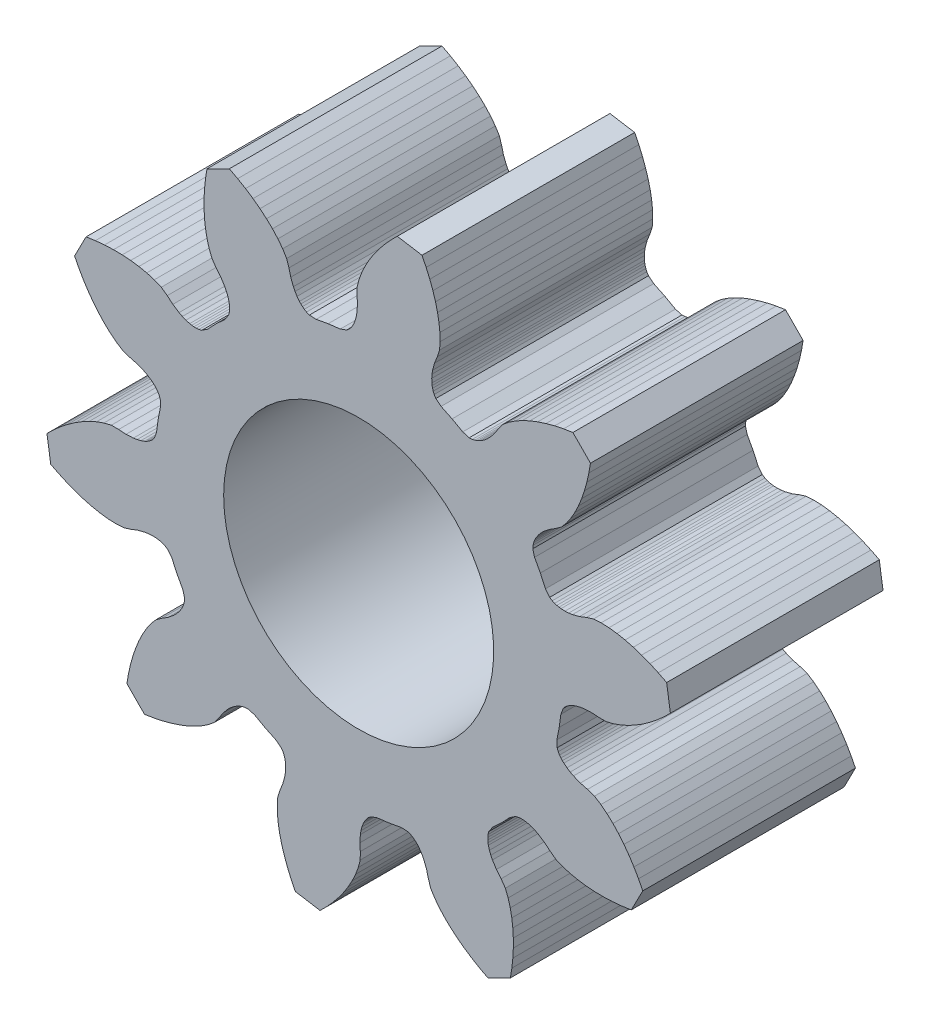
from build123d import *

# Parameters (mm, degrees)
EXTRUDE_GEAR_FACE_DEPTH = 10
SKETCH3_R               = 6.35
CUT_EXTRUDE1_DEPTH      = 24.004392687


with BuildPart() as part:
    # Sketch1 → Extrude gear face (new body)
    with BuildSketch(Plane.XY):
        Polygon((-8.785755588, -3.765027458), (-8.981475588, -3.515627458), (-9.104375588, -3.437067458), (-9.214815588, -3.388487458), (-9.318645588, -3.356197458), (-9.418135588, -3.334867458), (-9.514485588, -3.321697458), (-9.700295588, -3.313797458), (-9.879345588, -3.324657458), (-10.053295588, -3.350207458), (-10.389375588, -3.436367458), (-10.712795588, -3.560677458), (-11.043055588, -3.664357458), (-11.399975588, -3.686587458), (-11.767875588, -3.671647458), (-12.143785588, -3.625627458), (-12.525865588, -3.551357458), (-12.912635588, -3.450417458), (-13.302835588, -3.323837458), (-13.695295588, -3.172277458), (-14.088935588, -2.996237458), (-14.482675588, -2.796087458), (-14.659535588, -1.632117458), (-14.343025588, -1.324037458), (-14.019445588, -1.039017458), (-13.689715588, -0.777727458), (-13.354725588, -0.540947458), (-13.015395588, -0.329677458), (-12.672625588, -0.145267458), (-12.327345588, 0.010332542), (-11.980495588, 0.133882542), (-11.633085588, 0.218672542), (-11.286925588, 0.217772542), (-10.941175588, 0.195142542), (-10.594675588, 0.212702542), (-10.420995588, 0.239972542), (-10.246795588, 0.282782542), (-10.071725588, 0.345532542), (-9.983635588, 0.386722542), (-9.894965588, 0.436642542), (-9.805415588, 0.498312542), (-9.714385588, 0.577512542), (-9.620365588, 0.689032542), (-9.507565588, 0.985312542), (-9.431215588, 1.554652542), (-9.320805588, 2.118382542), (-9.332545588, 2.435192542), (-9.385805588, 2.570982542), (-9.446595588, 2.675212542), (-9.511615588, 2.762362542), (-9.579565588, 2.838102542), (-9.649775588, 2.905382542), (-9.795455588, 3.020992542), (-9.946695588, 3.117452542), (-10.102435588, 3.199022542), (-10.424975588, 3.326862542), (-10.759695588, 3.416392542), (-11.087825588, 3.526632542), (-11.389645588, 3.718442542), (-11.678495588, 3.946782542), (-11.955575588, 4.204962542), (-12.221015588, 4.489632542), (-12.474595588, 4.798622542), (-12.715865588, 5.130392542), (-12.944295588, 5.483682542), (-13.159275588, 5.857472542), (-13.360175588, 6.250842542), (-12.819095588, 7.296472542), (-12.381945588, 7.359662542), (-11.952645588, 7.400052542), (-11.532295588, 7.417632542), (-11.122115588, 7.412292542), (-10.723405588, 7.383762542), (-10.337705588, 7.331482542), (-9.966915588, 7.254412542), (-9.613685588, 7.150492542), (-9.282775588, 7.014882542), (-9.003265588, 6.810692542), (-8.736845588, 6.589162542), (-8.446195588, 6.399692542), (-8.289655588, 6.319672542), (-8.123565588, 6.251912542), (-7.945045588, 6.199772542), (-7.849565588, 6.181312542), (-7.748485588, 6.169592542), (-7.639795588, 6.166842542), (-7.519595588, 6.177412542), (-7.377995588, 6.212372542), (-7.112585588, 6.385762542), (-6.716155588, 6.801492542), (-6.295475588, 7.192662542), (-6.118765588, 7.455872542), (-6.082035588, 7.597022542), (-6.069955588, 7.717082542), (-6.071335588, 7.825802542), (-6.081785588, 7.927022542), (-6.099045588, 8.022722542), (-6.148945588, 8.201882542), (-6.214605588, 8.368812542), (-6.292655588, 8.526342542), (-6.478445588, 8.819352542), (-6.696615588, 9.088532542), (-6.897285588, 9.370582542), (-7.028725588, 9.703172542), (-7.128195588, 10.057682542), (-7.200595588, 10.429412542), (-7.248025588, 10.815742542), (-7.271545588, 11.214772542), (-7.271735588, 11.624992542), (-7.248875588, 12.045082542), (-7.203095588, 12.473852542), (-7.134405588, 12.910172542), (-6.082065588, 13.438062542), (-5.691255588, 13.232242542), (-5.320195588, 13.012582542), (-4.969795588, 12.779732542), (-4.641085588, 12.534302542), (-4.335305588, 12.276862542), (-4.053995588, 12.007862542), (-3.799315588, 11.727562542), (-3.574625588, 11.435872542), (-3.386625588, 11.131662542), (-3.280515588, 10.802172542), (-3.195195588, 10.466352542), (-3.071425588, 10.142232542), (-2.991815588, 9.985472542), (-2.897265588, 9.833042542), (-2.783495588, 9.685922542), (-2.717095588, 9.614872542), (-2.642215588, 9.545972542), (-2.555895588, 9.479852542), (-2.452435588, 9.417762542), (-2.317335588, 9.362802542), (-2.000695588, 9.347082542), (-1.435615588, 9.450402542), (-0.865355588, 9.519592542), (-0.567685588, 9.628662542), (-0.454995588, 9.721272542), (-0.374655588, 9.811292542), (-0.311875588, 9.900062542), (-0.260835588, 9.988102542), (-0.218545588, 10.075662542), (-0.153605588, 10.249942542), (-0.108605588, 10.423582542), (-0.079155588, 10.596902542), (-0.057245588, 10.943162542), (-0.075525588, 11.289172542), (-0.072075588, 11.635302542), (0.017074412, 11.981632542), (0.144974412, 12.326902542), (0.304904412, 12.670202542), (0.493604412, 13.010622542), (0.709124412, 13.347272542), (0.950094412, 13.679252542), (1.215504412, 14.005682542), (1.504574412, 14.325642542), (1.816604412, 14.638262542), (2.978254412, 14.446792542), (3.173444412, 14.050562542), (3.344524412, 13.654752542), (3.491134412, 13.260412542), (3.612814412, 12.868652542), (3.708874412, 12.480642542), (3.778344412, 12.097662542), (3.819634412, 11.721202542), (3.829954412, 11.353142542), (3.803234412, 10.996532542), (3.695414412, 10.667602542), (3.567044412, 10.345762542), (3.476674412, 10.010792542), (3.448934412, 9.837182542), (3.435824412, 9.658292542), (3.441394412, 9.472392542), (3.453354412, 9.375882542), (3.473434412, 9.276122542), (3.504404412, 9.171902542), (3.551604412, 9.060862542), (3.628614412, 8.936982542), (3.875534412, 8.738142542), (4.393414412, 8.489592542), (4.895434412, 8.210382542), (5.200374412, 8.123652542), (5.345974412, 8.132332542), (5.463884412, 8.157942542), (5.566854412, 8.192852542), (5.659894412, 8.234072542), (5.745574412, 8.280062542), (5.900544412, 8.382882542), (6.039014412, 8.496912542), (6.164724412, 8.619822542), (6.385974412, 8.887072542), (6.574564412, 9.177742542), (6.780804412, 9.455742542), (7.056494412, 9.683522542), (7.362904412, 9.887682542), (7.694074412, 10.071412542), (8.046834412, 10.235892542), (8.419074412, 10.381572542), (8.809154412, 10.508522542), (9.215754412, 10.616592542), (9.637674412, 10.705542542), (10.073864412, 10.775052542), (10.901124412, 9.937342542), (10.826134412, 9.502062542), (10.731884412, 9.081282542), (10.618714412, 8.676082542), (10.486874412, 8.287622542), (10.336534412, 7.917252542), (10.167624412, 7.566582542), (9.979744412, 7.237742542), (9.771754412, 6.933922542), (9.540534412, 6.661112542), (9.259954412, 6.458382542), (8.966944412, 6.273462542), (8.696934412, 6.055582542), (8.572454412, 5.931432542), (8.456694412, 5.794412542), (8.351934412, 5.640742542), (8.304874412, 5.555642542), (8.262484412, 5.463132542), (8.226284412, 5.360602542), (8.199204412, 5.243022542), (8.188684412, 5.097542542), (8.271574412, 4.791552542), (8.544454412, 4.286062542), (8.786484412, 3.765092542), (8.982204412, 3.515692542), (9.105104412, 3.437132542), (9.215544412, 3.388542542), (9.319364412, 3.356262542), (9.418864412, 3.334932542), (9.515214412, 3.321762542), (9.701024412, 3.313862542), (9.880074412, 3.324722542), (10.054014412, 3.350272542), (10.390094412, 3.436432542), (10.713524412, 3.560732542), (11.043784412, 3.664422542), (11.400704412, 3.686652542), (11.768604412, 3.671712542), (12.144514412, 3.625692542), (12.526594412, 3.551422542), (12.913364412, 3.450482542), (13.303564412, 3.323902542), (13.696024412, 3.172342542), (14.089654412, 2.996302542), (14.483404412, 2.796152542), (14.660264412, 1.632182542), (14.343754412, 1.324102542), (14.020174412, 1.039082542), (13.690444412, 0.777792542), (13.355454412, 0.541012542), (13.016124412, 0.329742542), (12.673354412, 0.145332542), (12.328074412, -0.010267458), (11.981224412, -0.133817458), (11.633804412, -0.218607458), (11.287654412, -0.217707458), (10.941904412, -0.195077458), (10.595404412, -0.212637458), (10.421724412, -0.239907458), (10.247524412, -0.282727458), (10.072454412, -0.345467458), (9.984364412, -0.386657458), (9.895694412, -0.436577458), (9.806144412, -0.498247458), (9.715114412, -0.577447458), (9.621094412, -0.688967458), (9.508294412, -0.985247458), (9.431944412, -1.554587458), (9.321524412, -2.118327458), (9.333274412, -2.435137458), (9.386524412, -2.570917458), (9.447314412, -2.675147458), (9.512344412, -2.762297458), (9.580294412, -2.838037458), (9.650504412, -2.905317458), (9.796184412, -3.020937458), (9.947424412, -3.117387458), (10.103164412, -3.198957458), (10.425704412, -3.326797458), (10.760424412, -3.416337458), (11.088554412, -3.526567458), (11.390374412, -3.718377458), (11.679224412, -3.946717458), (11.956304412, -4.204897458), (12.221744412, -4.489567458), (12.475324412, -4.798557458), (12.716594412, -5.130327458), (12.945024412, -5.483627458), (13.160004412, -5.857417458), (13.360904412, -6.250777458), (12.819824412, -7.296407458), (12.382674412, -7.359597458), (11.953364412, -7.399997458), (11.533024412, -7.417577458), (11.122844412, -7.412227458), (10.724134412, -7.383697458), (10.338434412, -7.331417458), (9.967634412, -7.254347458), (9.614404412, -7.150427458), (9.283504412, -7.014817458), (9.003994412, -6.810627458), (8.737574412, -6.589097458), (8.446924412, -6.399627458), (8.290384412, -6.319607458), (8.124294412, -6.251857458), (7.945774412, -6.199707458), (7.850294412, -6.181247458), (7.749214412, -6.169527458), (7.640524412, -6.166777458), (7.520324412, -6.177347458), (7.378714412, -6.212307458), (7.113314412, -6.385697458), (6.716884412, -6.801427458), (6.296204412, -7.192597458), (6.119494412, -7.455807458), (6.082764412, -7.596967458), (6.070674412, -7.717017458), (6.072064412, -7.825737458), (6.082514412, -7.926957458), (6.099774412, -8.022657458), (6.149674412, -8.201817458), (6.215324412, -8.368747458), (6.293384412, -8.526277458), (6.479174412, -8.819287458), (6.697344412, -9.088467458), (6.898014412, -9.370527458), (7.029444412, -9.703107458), (7.128924412, -10.057617458), (7.201324412, -10.429347458), (7.248754412, -10.815677458), (7.272274412, -11.214707458), (7.272464412, -11.624927458), (7.249604412, -12.045017458), (7.203824412, -12.473787458), (7.135134412, -12.910107458), (6.082784412, -13.437997458), (5.691984412, -13.232177458), (5.320924412, -13.012517458), (4.970524412, -12.779667458), (4.641814412, -12.534247458), (4.336034412, -12.276807458), (4.054724412, -12.007797458), (3.800044412, -11.727507458), (3.575354412, -11.435807458), (3.387354412, -11.131597458), (3.281244412, -10.802107458), (3.195924412, -10.466287458), (3.072154412, -10.142167458), (2.992544412, -9.985417458), (2.897994412, -9.832977458), (2.784224412, -9.685857458), (2.717824412, -9.614807458), (2.642944412, -9.545907458), (2.556624412, -9.479797458), (2.453164412, -9.417697458), (2.318054412, -9.362737458), (2.001424412, -9.347017458), (1.436344412, -9.450337458), (0.866084412, -9.519527458), (0.568414412, -9.628597458), (0.455724412, -9.721207458), (0.375384412, -9.811227458), (0.312594412, -9.899997458), (0.261564412, -9.988037458), (0.219264412, -10.075597458), (0.154334412, -10.249877458), (0.109334412, -10.423517458), (0.079874412, -10.596847458), (0.057964412, -10.943097458), (0.076244412, -11.289107458), (0.072804412, -11.635237458), (-0.016345588, -11.981567458), (-0.144245588, -12.326837458), (-0.304175588, -12.670137458), (-0.492885588, -13.010557458), (-0.708395588, -13.347207458), (-0.949365588, -13.679187458), (-1.214785588, -14.005617458), (-1.503845588, -14.325587458), (-1.815875588, -14.638207458), (-2.977525588, -14.446727458), (-3.172715588, -14.050497458), (-3.343795588, -13.654687458), (-3.490405588, -13.260347458), (-3.612085588, -12.868587458), (-3.708145588, -12.480577458), (-3.777615588, -12.097597458), (-3.818905588, -11.721137458), (-3.829225588, -11.353077458), (-3.802515588, -10.996467458), (-3.694685588, -10.667537458), (-3.566325588, -10.345697458), (-3.475945588, -10.010727458), (-3.448205588, -9.837117458), (-3.435095588, -9.658227458), (-3.440675588, -9.472327458), (-3.452625588, -9.375817458), (-3.472705588, -9.276067458), (-3.503685588, -9.171837458), (-3.550875588, -9.060797458), (-3.627885588, -8.936917458), (-3.874805588, -8.738077458), (-4.392685588, -8.489527458), (-4.894715588, -8.210317458), (-5.199645588, -8.123587458), (-5.345245588, -8.132277458), (-5.463155588, -8.157877458), (-5.566125588, -8.192787458), (-5.659165588, -8.234017458), (-5.744845588, -8.279997458), (-5.899815588, -8.382817458), (-6.038285588, -8.496847458), (-6.163995588, -8.619757458), (-6.385245588, -8.887007458), (-6.573835588, -9.177677458), (-6.780075588, -9.455677458), (-7.055765588, -9.683457458), (-7.362185588, -9.887617458), (-7.693345588, -10.071347458), (-8.046115588, -10.235837458), (-8.418345588, -10.381517458), (-8.808425588, -10.508457458), (-9.215025588, -10.616527458), (-9.636955588, -10.705487458), (-10.073145588, -10.774987458), (-10.900395588, -9.937277458), (-10.825405588, -9.501997458), (-10.731165588, -9.081217458), (-10.617985588, -8.676017458), (-10.486155588, -8.287557458), (-10.335805588, -7.917187458), (-10.166895588, -7.566517458), (-9.979015588, -7.237687458), (-9.771035588, -6.933857458), (-9.539805588, -6.661047458), (-9.259225588, -6.458317458), (-8.966215588, -6.273397458), (-8.696205588, -6.055527458), (-8.571725588, -5.931367458), (-8.455965588, -5.794347458), (-8.351205588, -5.640677458), (-8.304145588, -5.555577458), (-8.261755588, -5.463067458), (-8.225555588, -5.360537458), (-8.198475588, -5.242957458), (-8.187955588, -5.097487458), (-8.270845588, -4.791487458), (-8.543725588, -4.285997458), align=None)
    extrude(amount=EXTRUDE_GEAR_FACE_DEPTH)

    # Sketch3 → Cut-Extrude1 (cut, through all)
    with BuildSketch(Plane(origin=(0, 0, 0), x_dir=(-1, 0, 0), z_dir=(0, 0, -1))):
        Circle(SKETCH3_R)
    extrude(amount=-CUT_EXTRUDE1_DEPTH, mode=Mode.SUBTRACT)


solid = part.part
